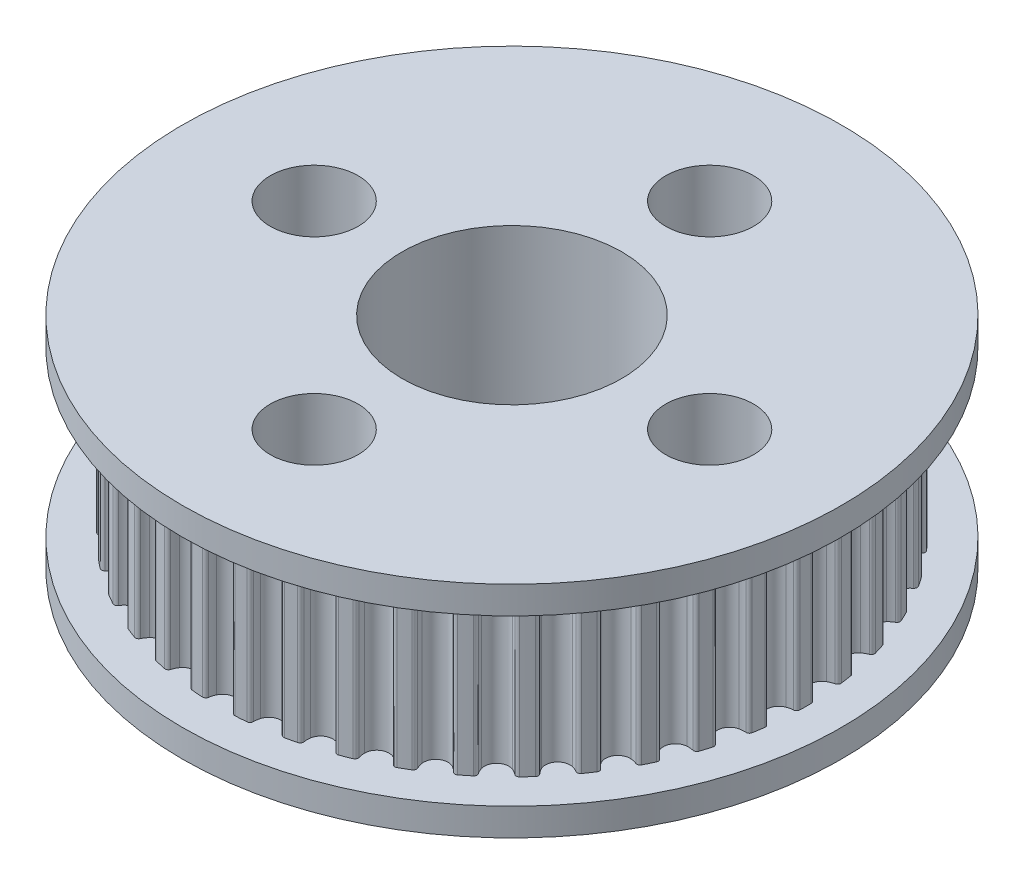
from build123d import *

# Parameters (mm, degrees)
BOSS_EXTRUDE1_DEPTH = 5
SKETCH3_R           = 15
BOSS_EXTRUDE2_DEPTH = 1.25
SKETCH4_R           = 2
SKETCH4_R_2         = 5
CUT_EXTRUDE1_DEPTH  = 24.452078799
SKETCH5_R           = 3.5
CUT_EXTRUDE2_DEPTH  = 2


with BuildPart() as part:
    # Sketch2 → Boss-Extrude1 (new, symmetric)
    with BuildSketch(Plane(origin=(0, 0, 0), x_dir=(1, 0, 0), z_dir=(0, 1, 0))):
        with BuildLine():
            ThreePointArc((-0.587933358, 13.215922323), (-0.641402083, 13.310557741), (-0.744749539, 13.344233703))
            ThreePointArc((-0.744749539, 13.344233703), (-0.998767701, 13.327628749), (-1.252423529, 13.306188797))
            ThreePointArc((-1.252423529, 13.306188797), (-1.349597538, 13.257485829), (-1.388364385, 13.15593831))
            ThreePointArc((-1.388364385, 13.15593831), (-1.398406592, 13.008375791), (-1.43010426, 12.863908491))
            ThreePointArc((-1.43010426, 12.863908491), (-1.880019146, 12.473112042), (-2.42513485, 12.713931761))
            ThreePointArc((-2.42513485, 12.713931761), (-2.498006764, 12.842637732), (-2.55109764, 12.98068447))
            ThreePointArc((-2.55109764, 12.98068447), (-2.618073842, 13.066293789), (-2.725286134, 13.084190479))
            ThreePointArc((-2.725286134, 13.084190479), (-2.973992282, 13.029911546), (-3.221619526, 12.970905621))
            ThreePointArc((-3.221619526, 12.970905621), (-3.31044938, 12.90826359), (-3.333648361, 12.802072375))
            ThreePointArc((-3.333648361, 12.802072375), (-3.321585353, 12.654661294), (-3.331397251, 12.507083282))
            ThreePointArc((-3.331397251, 12.507083282), (-3.71804177, 12.053595372), (-4.292961299, 12.210480054))
            ThreePointArc((-4.292961299, 12.210480054), (-4.384201924, 12.326887491), (-4.457274617, 12.455479576))
            ThreePointArc((-4.457274617, 12.455479576), (-4.536262157, 12.530150425), (-4.644944339, 12.53186806))
            ThreePointArc((-4.644944339, 12.53186806), (-4.882782791, 12.441127651), (-5.118849866, 12.345873847))
            ThreePointArc((-5.118849866, 12.345873847), (-5.197351254, 12.270692074), (-5.204464142, 12.162229297))
            ThreePointArc((-5.204464142, 12.162229297), (-5.170565386, 12.018262574), (-5.158272331, 11.8708705))
            ThreePointArc((-5.158272331, 11.8708705), (-5.473009485, 11.3648213), (-6.064890087, 11.4342664))
            ThreePointArc((-6.064890087, 11.4342664), (-6.172461257, 11.535774952), (-6.263883445, 11.65203985))
            ThreePointArc((-6.263883445, 11.65203985), (-6.353117871, 11.714104205), (-6.460842164, 11.699604418))
            ThreePointArc((-6.460842164, 11.699604418), (-6.6825, 11.574429522), (-6.901733558, 11.445055653))
            ThreePointArc((-6.901733558, 11.445055653), (-6.968152889, 11.359013573), (-6.959020794, 11.250702115))
            ThreePointArc((-6.959020794, 11.250702115), (-6.904043532, 11.113395729), (-6.869920132, 10.969482086))
            ThreePointArc((-6.869920132, 10.969482086), (-7.105719212, 10.422175899), (-7.701339252, 10.402630129))
            ThreePointArc((-7.701339252, 10.402630129), (-7.822838006, 10.486972263), (-7.930567467, 10.588312808))
            ThreePointArc((-7.930567467, 10.588312808), (-8.028055431, 10.636384255), (-8.132415451, 10.605990945))
            ThreePointArc((-8.132415451, 10.605990945), (-8.332941202, 10.449177763), (-8.530443928, 10.288573827))
            ThreePointArc((-8.530443928, 10.288573827), (-8.583297503, 10.193593478), (-8.55812442, 10.087852838))
            ThreePointArc((-8.55812442, 10.087852838), (-8.483296754, 9.960273987), (-8.428105269, 9.82305357))
            ThreePointArc((-8.428105269, 9.82305357), (-8.579698914, 9.246716311), (-9.165753224, 9.13861629))
            ThreePointArc((-9.165753224, 9.13861629), (-9.29846548, 9.203907943), (-9.420095717, 9.288060355))
            ThreePointArc((-9.420095717, 9.288060355), (-9.523659498, 9.321065057), (-9.622324015, 9.275457161))
            ThreePointArc((-9.622324015, 9.275457161), (-9.797238267, 9.09050864), (-9.968598276, 8.902262264))
            ThreePointArc((-9.968598276, 8.902262264), (-10.006705434, 8.80046535), (-9.966053689, 8.699657599))
            ThreePointArc((-9.966053689, 8.699657599), (-9.873047146, 8.584656183), (-9.798020462, 8.457194269))
            ThreePointArc((-9.798020462, 8.457194269), (-9.86202232, 7.864700361), (-10.425419415, 7.670460865))
            ThreePointArc((-10.425419415, 7.670460865), (-10.566380601, 7.715243529), (-10.699194595, 7.780327982))
            ThreePointArc((-10.699194595, 7.780327982), (-10.806520749, 7.797528667), (-10.897285761, 7.737724991))
            ThreePointArc((-10.897285761, 7.737724991), (-11.042681219, 7.528772576), (-11.184070611, 7.317088872))
            ThreePointArc((-11.184070611, 7.317088872), (-11.206580101, 7.210749369), (-11.151357787, 7.117126385))
            ThreePointArc((-11.151357787, 7.117126385), (-11.042249978, 7.017271346), (-10.949064068, 6.902415222))
            ThreePointArc((-10.949064068, 6.902415222), (-10.924044443, 6.307), (-11.452198964, 6.030960019))
            ThreePointArc((-11.452198964, 6.030960019), (-11.59826024, 6.054233323), (-11.739291145, 6.098795938))
            ThreePointArc((-11.739291145, 6.098795938), (-11.847982184, 6.099808373), (-11.928820151, 6.027144831))
            ThreePointArc((-11.928820151, 6.027144831), (-12.04144892, 5.798856173), (-12.14970929, 5.568463806))
            ThreePointArc((-12.14970929, 5.568463806), (-12.156118287, 5.459957162), (-12.087558979, 5.375610328))
            ThreePointArc((-12.087558979, 5.375610328), (-11.964787193, 5.293132262), (-11.855523675, 5.193447626))
            ThreePointArc((-11.855523675, 5.193447626), (-11.742041465, 4.608411681), (-12.223155312, 4.256737492))
            ThreePointArc((-12.223155312, 4.256737492), (-12.37105391, 4.257981549), (-12.51715133, 4.281026871))
            ThreePointArc((-12.51715133, 4.281026871), (-12.624779275, 4.265828439), (-12.69388441, 4.181928215))
            ThreePointArc((-12.69388441, 4.181928215), (-12.771230549, 3.939402906), (-12.843943541, 3.69544846))
            ThreePointArc((-12.843943541, 3.69544846), (-12.834108878, 3.587198534), (-12.753744078, 3.514012019))
            ThreePointArc((-12.753744078, 3.514012019), (-12.620050833, 3.45075335), (-12.497150475, 3.368466992))
            ThreePointArc((-12.497150475, 3.368466992), (-12.297740684, 2.806879061), (-12.721066569, 2.387426484))
            ThreePointArc((-12.721066569, 2.387426484), (-12.867498678, 2.366613504), (-13.015399038, 2.367626738))
            ThreePointArc((-13.015399038, 2.367626738), (-13.119559659, 2.336556946), (-13.175388267, 2.243294233))
            ThreePointArc((-13.175388267, 2.243294233), (-13.215723992, 1.991949887), (-13.251265316, 1.739882902))
            ThreePointArc((-13.251265316, 1.739882902), (-13.225406685, 1.634307819), (-13.135031609, 1.573916489))
            ThreePointArc((-13.135031609, 1.573916489), (-12.993403392, 1.531290311), (-12.859611583, 1.468240371))
            ThreePointArc((-12.859611583, 1.468240371), (-12.578728698, 0.9426454), (-12.934810219, 0.464784313))
            ThreePointArc((-12.934810219, 0.464784313), (-13.076504789, 0.422379223), (-13.222904238, 0.401337735))
            ThreePointArc((-13.222904238, 0.401337735), (-13.32127076, 0.355090633), (-13.362575722, 0.254548765))
            ThreePointArc((-13.362575722, 0.254548765), (-13.365, 0), (-13.362575722, -0.254548765))
            ThreePointArc((-13.362575722, -0.254548765), (-13.32127076, -0.355090633), (-13.222904238, -0.401337735))
            ThreePointArc((-13.222904238, -0.401337735), (-13.076504789, -0.422379223), (-12.934810219, -0.464784313))
            ThreePointArc((-12.934810219, -0.464784313), (-12.578728698, -0.9426454), (-12.859611583, -1.468240371))
            ThreePointArc((-12.859611583, -1.468240371), (-12.993403392, -1.531290311), (-13.135031609, -1.573916489))
            ThreePointArc((-13.135031609, -1.573916489), (-13.225406685, -1.634307819), (-13.251265316, -1.739882902))
            ThreePointArc((-13.251265316, -1.739882902), (-13.215723992, -1.991949887), (-13.175388267, -2.243294233))
            ThreePointArc((-13.175388267, -2.243294233), (-13.119559659, -2.336556946), (-13.015399038, -2.367626738))
            ThreePointArc((-13.015399038, -2.367626738), (-12.867498678, -2.366613504), (-12.721066569, -2.387426484))
            ThreePointArc((-12.721066569, -2.387426484), (-12.297740684, -2.806879061), (-12.497150475, -3.368466992))
            ThreePointArc((-12.497150475, -3.368466992), (-12.620050833, -3.45075335), (-12.753744078, -3.514012019))
            ThreePointArc((-12.753744078, -3.514012019), (-12.834108878, -3.587198534), (-12.843943541, -3.69544846))
            ThreePointArc((-12.843943541, -3.69544846), (-12.771230549, -3.939402906), (-12.69388441, -4.181928215))
            ThreePointArc((-12.69388441, -4.181928215), (-12.624779275, -4.265828439), (-12.51715133, -4.281026871))
            ThreePointArc((-12.51715133, -4.281026871), (-12.37105391, -4.257981549), (-12.223155312, -4.256737492))
            ThreePointArc((-12.223155312, -4.256737492), (-11.742041465, -4.608411681), (-11.855523675, -5.193447626))
            ThreePointArc((-11.855523675, -5.193447626), (-11.964787193, -5.293132262), (-12.087558979, -5.375610328))
            ThreePointArc((-12.087558979, -5.375610328), (-12.156118287, -5.459957162), (-12.14970929, -5.568463806))
            ThreePointArc((-12.14970929, -5.568463806), (-12.04144892, -5.798856173), (-11.928820151, -6.027144831))
            ThreePointArc((-11.928820151, -6.027144831), (-11.847982184, -6.099808373), (-11.739291145, -6.098795938))
            ThreePointArc((-11.739291145, -6.098795938), (-11.59826024, -6.054233323), (-11.452198964, -6.030960019))
            ThreePointArc((-11.452198964, -6.030960019), (-10.924044443, -6.307), (-10.949064068, -6.902415222))
            ThreePointArc((-10.949064068, -6.902415222), (-11.042249978, -7.017271346), (-11.151357787, -7.117126385))
            ThreePointArc((-11.151357787, -7.117126385), (-11.206580101, -7.210749369), (-11.184070611, -7.317088872))
            ThreePointArc((-11.184070611, -7.317088872), (-11.042681219, -7.528772576), (-10.897285761, -7.737724991))
            ThreePointArc((-10.897285761, -7.737724991), (-10.806520749, -7.797528667), (-10.699194595, -7.780327982))
            ThreePointArc((-10.699194595, -7.780327982), (-10.566380601, -7.715243529), (-10.425419415, -7.670460865))
            ThreePointArc((-10.425419415, -7.670460865), (-9.86202232, -7.864700361), (-9.798020462, -8.457194269))
            ThreePointArc((-9.798020462, -8.457194269), (-9.873047146, -8.584656183), (-9.966053689, -8.699657599))
            ThreePointArc((-9.966053689, -8.699657599), (-10.006705434, -8.80046535), (-9.968598276, -8.902262264))
            ThreePointArc((-9.968598276, -8.902262264), (-9.797238267, -9.09050864), (-9.622324015, -9.275457161))
            ThreePointArc((-9.622324015, -9.275457161), (-9.523659498, -9.321065057), (-9.420095717, -9.288060355))
            ThreePointArc((-9.420095717, -9.288060355), (-9.29846548, -9.203907943), (-9.165753224, -9.13861629))
            ThreePointArc((-9.165753224, -9.13861629), (-8.579698914, -9.246716311), (-8.428105269, -9.82305357))
            ThreePointArc((-8.428105269, -9.82305357), (-8.483296754, -9.960273987), (-8.55812442, -10.087852838))
            ThreePointArc((-8.55812442, -10.087852838), (-8.583297503, -10.193593478), (-8.530443928, -10.288573827))
            ThreePointArc((-8.530443928, -10.288573827), (-8.332941202, -10.449177763), (-8.132415451, -10.605990945))
            ThreePointArc((-8.132415451, -10.605990945), (-8.028055431, -10.636384255), (-7.930567467, -10.588312808))
            ThreePointArc((-7.930567467, -10.588312808), (-7.822838006, -10.486972263), (-7.701339252, -10.402630129))
            ThreePointArc((-7.701339252, -10.402630129), (-7.105719212, -10.422175899), (-6.869920132, -10.969482086))
            ThreePointArc((-6.869920132, -10.969482086), (-6.904043532, -11.113395729), (-6.959020794, -11.250702115))
            ThreePointArc((-6.959020794, -11.250702115), (-6.968152889, -11.359013573), (-6.901733558, -11.445055653))
            ThreePointArc((-6.901733558, -11.445055653), (-6.6825, -11.574429522), (-6.460842164, -11.699604418))
            ThreePointArc((-6.460842164, -11.699604418), (-6.353117871, -11.714104205), (-6.263883445, -11.65203985))
            ThreePointArc((-6.263883445, -11.65203985), (-6.172461257, -11.535774952), (-6.064890087, -11.4342664))
            ThreePointArc((-6.064890087, -11.4342664), (-5.473009485, -11.3648213), (-5.158272331, -11.8708705))
            ThreePointArc((-5.158272331, -11.8708705), (-5.170565386, -12.018262574), (-5.204464142, -12.162229297))
            ThreePointArc((-5.204464142, -12.162229297), (-5.197351254, -12.270692074), (-5.118849866, -12.345873847))
            ThreePointArc((-5.118849866, -12.345873847), (-4.882782791, -12.441127651), (-4.644944339, -12.53186806))
            ThreePointArc((-4.644944339, -12.53186806), (-4.536262157, -12.530150425), (-4.457274617, -12.455479576))
            ThreePointArc((-4.457274617, -12.455479576), (-4.384201924, -12.326887491), (-4.292961299, -12.210480054))
            ThreePointArc((-4.292961299, -12.210480054), (-3.71804177, -12.053595372), (-3.331397251, -12.507083282))
            ThreePointArc((-3.331397251, -12.507083282), (-3.321585353, -12.654661294), (-3.333648361, -12.802072375))
            ThreePointArc((-3.333648361, -12.802072375), (-3.31044938, -12.90826359), (-3.221619526, -12.970905621))
            ThreePointArc((-3.221619526, -12.970905621), (-2.973992282, -13.029911546), (-2.725286134, -13.084190479))
            ThreePointArc((-2.725286134, -13.084190479), (-2.618073842, -13.066293789), (-2.55109764, -12.98068447))
            ThreePointArc((-2.55109764, -12.98068447), (-2.498006764, -12.842637732), (-2.42513485, -12.713931761))
            ThreePointArc((-2.42513485, -12.713931761), (-1.880019146, -12.473112042), (-1.43010426, -12.863908491))
            ThreePointArc((-1.43010426, -12.863908491), (-1.398406592, -13.008375791), (-1.388364385, -13.15593831))
            ThreePointArc((-1.388364385, -13.15593831), (-1.349597538, -13.257485829), (-1.252423529, -13.306188797))
            ThreePointArc((-1.252423529, -13.306188797), (-0.998767701, -13.327628749), (-0.744749539, -13.344233703))
            ThreePointArc((-0.744749539, -13.344233703), (-0.641402083, -13.310557741), (-0.587933358, -13.215922323))
            ThreePointArc((-0.587933358, -13.215922323), (-0.556010261, -13.071504669), (-0.503134896, -12.933375242))
            ThreePointArc((-0.503134896, -12.933375242), (0, -12.614), (0.503134896, -12.933375242))
            ThreePointArc((0.503134896, -12.933375242), (0.556010261, -13.071504669), (0.587933358, -13.215922323))
            ThreePointArc((0.587933358, -13.215922323), (0.641402083, -13.310557741), (0.744749539, -13.344233703))
            ThreePointArc((0.744749539, -13.344233703), (0.998767701, -13.327628749), (1.252423529, -13.306188797))
            ThreePointArc((1.252423529, -13.306188797), (1.349597538, -13.257485829), (1.388364385, -13.15593831))
            ThreePointArc((1.388364385, -13.15593831), (1.398406592, -13.008375791), (1.43010426, -12.863908491))
            ThreePointArc((1.43010426, -12.863908491), (1.880019146, -12.473112042), (2.42513485, -12.713931761))
            ThreePointArc((2.42513485, -12.713931761), (2.498006764, -12.842637732), (2.55109764, -12.98068447))
            ThreePointArc((2.55109764, -12.98068447), (2.618073842, -13.066293789), (2.725286134, -13.084190479))
            ThreePointArc((2.725286134, -13.084190479), (2.973992282, -13.029911546), (3.221619526, -12.970905621))
            ThreePointArc((3.221619526, -12.970905621), (3.31044938, -12.90826359), (3.333648361, -12.802072375))
            ThreePointArc((3.333648361, -12.802072375), (3.321585353, -12.654661294), (3.331397251, -12.507083282))
            ThreePointArc((3.331397251, -12.507083282), (3.71804177, -12.053595372), (4.292961299, -12.210480054))
            ThreePointArc((4.292961299, -12.210480054), (4.384201924, -12.326887491), (4.457274617, -12.455479576))
            ThreePointArc((4.457274617, -12.455479576), (4.536262157, -12.530150425), (4.644944339, -12.53186806))
            ThreePointArc((4.644944339, -12.53186806), (4.882782791, -12.441127651), (5.118849866, -12.345873847))
            ThreePointArc((5.118849866, -12.345873847), (5.197351254, -12.270692074), (5.204464142, -12.162229297))
            ThreePointArc((5.204464142, -12.162229297), (5.170565386, -12.018262574), (5.158272331, -11.8708705))
            ThreePointArc((5.158272331, -11.8708705), (5.473009485, -11.3648213), (6.064890087, -11.4342664))
            ThreePointArc((6.064890087, -11.4342664), (6.172461257, -11.535774952), (6.263883445, -11.65203985))
            ThreePointArc((6.263883445, -11.65203985), (6.353117871, -11.714104205), (6.460842164, -11.699604418))
            ThreePointArc((6.460842164, -11.699604418), (6.6825, -11.574429522), (6.901733558, -11.445055653))
            ThreePointArc((6.901733558, -11.445055653), (6.968152889, -11.359013573), (6.959020794, -11.250702115))
            ThreePointArc((6.959020794, -11.250702115), (6.904043532, -11.113395729), (6.869920132, -10.969482086))
            ThreePointArc((6.869920132, -10.969482086), (7.105719212, -10.422175899), (7.701339252, -10.402630129))
            ThreePointArc((7.701339252, -10.402630129), (7.822838006, -10.486972263), (7.930567467, -10.588312808))
            ThreePointArc((7.930567467, -10.588312808), (8.028055431, -10.636384255), (8.132415451, -10.605990945))
            ThreePointArc((8.132415451, -10.605990945), (8.332941202, -10.449177763), (8.530443928, -10.288573827))
            ThreePointArc((8.530443928, -10.288573827), (8.583297503, -10.193593478), (8.55812442, -10.087852838))
            ThreePointArc((8.55812442, -10.087852838), (8.483296754, -9.960273987), (8.428105269, -9.82305357))
            ThreePointArc((8.428105269, -9.82305357), (8.579698914, -9.246716311), (9.165753224, -9.13861629))
            ThreePointArc((9.165753224, -9.13861629), (9.29846548, -9.203907943), (9.420095717, -9.288060355))
            ThreePointArc((9.420095717, -9.288060355), (9.523659498, -9.321065057), (9.622324015, -9.275457161))
            ThreePointArc((9.622324015, -9.275457161), (9.797238267, -9.09050864), (9.968598276, -8.902262264))
            ThreePointArc((9.968598276, -8.902262264), (10.006705434, -8.80046535), (9.966053689, -8.699657599))
            ThreePointArc((9.966053689, -8.699657599), (9.873047146, -8.584656183), (9.798020462, -8.457194269))
            ThreePointArc((9.798020462, -8.457194269), (9.86202232, -7.864700361), (10.425419415, -7.670460865))
            ThreePointArc((10.425419415, -7.670460865), (10.566380601, -7.715243529), (10.699194595, -7.780327982))
            ThreePointArc((10.699194595, -7.780327982), (10.806520749, -7.797528667), (10.897285761, -7.737724991))
            ThreePointArc((10.897285761, -7.737724991), (11.042681219, -7.528772576), (11.184070611, -7.317088872))
            ThreePointArc((11.184070611, -7.317088872), (11.206580101, -7.210749369), (11.151357787, -7.117126385))
            ThreePointArc((11.151357787, -7.117126385), (11.042249978, -7.017271346), (10.949064068, -6.902415222))
            ThreePointArc((10.949064068, -6.902415222), (10.924044443, -6.307), (11.452198964, -6.030960019))
            ThreePointArc((11.452198964, -6.030960019), (11.59826024, -6.054233323), (11.739291145, -6.098795938))
            ThreePointArc((11.739291145, -6.098795938), (11.847982184, -6.099808373), (11.928820151, -6.027144831))
            ThreePointArc((11.928820151, -6.027144831), (12.04144892, -5.798856173), (12.14970929, -5.568463806))
            ThreePointArc((12.14970929, -5.568463806), (12.156118287, -5.459957162), (12.087558979, -5.375610328))
            ThreePointArc((12.087558979, -5.375610328), (11.964787193, -5.293132262), (11.855523675, -5.193447626))
            ThreePointArc((11.855523675, -5.193447626), (11.742041465, -4.608411681), (12.223155312, -4.256737492))
            ThreePointArc((12.223155312, -4.256737492), (12.37105391, -4.257981549), (12.51715133, -4.281026871))
            ThreePointArc((12.51715133, -4.281026871), (12.624779275, -4.265828439), (12.69388441, -4.181928215))
            ThreePointArc((12.69388441, -4.181928215), (12.771230549, -3.939402906), (12.843943541, -3.69544846))
            ThreePointArc((12.843943541, -3.69544846), (12.834108878, -3.587198534), (12.753744078, -3.514012019))
            ThreePointArc((12.753744078, -3.514012019), (12.620050833, -3.45075335), (12.497150475, -3.368466992))
            ThreePointArc((12.497150475, -3.368466992), (12.297740684, -2.806879061), (12.721066569, -2.387426484))
            ThreePointArc((12.721066569, -2.387426484), (12.867498678, -2.366613504), (13.015399038, -2.367626738))
            ThreePointArc((13.015399038, -2.367626738), (13.119559659, -2.336556946), (13.175388267, -2.243294233))
            ThreePointArc((13.175388267, -2.243294233), (13.215723992, -1.991949887), (13.251265316, -1.739882902))
            ThreePointArc((13.251265316, -1.739882902), (13.225406685, -1.634307819), (13.135031609, -1.573916489))
            ThreePointArc((13.135031609, -1.573916489), (12.993403392, -1.531290311), (12.859611583, -1.468240371))
            ThreePointArc((12.859611583, -1.468240371), (12.578728698, -0.9426454), (12.934810219, -0.464784313))
            ThreePointArc((12.934810219, -0.464784313), (13.076504789, -0.422379223), (13.222904238, -0.401337735))
            ThreePointArc((13.222904238, -0.401337735), (13.32127076, -0.355090633), (13.362575722, -0.254548765))
            ThreePointArc((13.362575722, -0.254548765), (13.365, 0), (13.362575722, 0.254548765))
            ThreePointArc((13.362575722, 0.254548765), (13.32127076, 0.355090633), (13.222904238, 0.401337735))
            ThreePointArc((13.222904238, 0.401337735), (13.076504789, 0.422379223), (12.934810219, 0.464784313))
            ThreePointArc((12.934810219, 0.464784313), (12.578728698, 0.9426454), (12.859611583, 1.468240371))
            ThreePointArc((12.859611583, 1.468240371), (12.993403392, 1.531290311), (13.135031609, 1.573916489))
            ThreePointArc((13.135031609, 1.573916489), (13.225406685, 1.634307819), (13.251265316, 1.739882902))
            ThreePointArc((13.251265316, 1.739882902), (13.215723992, 1.991949887), (13.175388267, 2.243294233))
            ThreePointArc((13.175388267, 2.243294233), (13.119559659, 2.336556946), (13.015399038, 2.367626738))
            ThreePointArc((13.015399038, 2.367626738), (12.867498678, 2.366613504), (12.721066569, 2.387426484))
            ThreePointArc((12.721066569, 2.387426484), (12.297740684, 2.806879061), (12.497150475, 3.368466992))
            ThreePointArc((12.497150475, 3.368466992), (12.620050833, 3.45075335), (12.753744078, 3.514012019))
            ThreePointArc((12.753744078, 3.514012019), (12.834108878, 3.587198534), (12.843943541, 3.69544846))
            ThreePointArc((12.843943541, 3.69544846), (12.771230549, 3.939402906), (12.69388441, 4.181928215))
            ThreePointArc((12.69388441, 4.181928215), (12.624779275, 4.265828439), (12.51715133, 4.281026871))
            ThreePointArc((12.51715133, 4.281026871), (12.37105391, 4.257981549), (12.223155312, 4.256737492))
            ThreePointArc((12.223155312, 4.256737492), (11.742041465, 4.608411681), (11.855523675, 5.193447626))
            ThreePointArc((11.855523675, 5.193447626), (11.964787193, 5.293132262), (12.087558979, 5.375610328))
            ThreePointArc((12.087558979, 5.375610328), (12.156118287, 5.459957162), (12.14970929, 5.568463806))
            ThreePointArc((12.14970929, 5.568463806), (12.04144892, 5.798856173), (11.928820151, 6.027144831))
            ThreePointArc((11.928820151, 6.027144831), (11.847982184, 6.099808373), (11.739291145, 6.098795938))
            ThreePointArc((11.739291145, 6.098795938), (11.59826024, 6.054233323), (11.452198964, 6.030960019))
            ThreePointArc((11.452198964, 6.030960019), (10.924044443, 6.307), (10.949064068, 6.902415222))
            ThreePointArc((10.949064068, 6.902415222), (11.042249978, 7.017271346), (11.151357787, 7.117126385))
            ThreePointArc((11.151357787, 7.117126385), (11.206580101, 7.210749369), (11.184070611, 7.317088872))
            ThreePointArc((11.184070611, 7.317088872), (11.042681219, 7.528772576), (10.897285761, 7.737724991))
            ThreePointArc((10.897285761, 7.737724991), (10.806520749, 7.797528667), (10.699194595, 7.780327982))
            ThreePointArc((10.699194595, 7.780327982), (10.566380601, 7.715243529), (10.425419415, 7.670460865))
            ThreePointArc((10.425419415, 7.670460865), (9.86202232, 7.864700361), (9.798020462, 8.457194269))
            ThreePointArc((9.798020462, 8.457194269), (9.873047146, 8.584656183), (9.966053689, 8.699657599))
            ThreePointArc((9.966053689, 8.699657599), (10.006705434, 8.80046535), (9.968598276, 8.902262264))
            ThreePointArc((9.968598276, 8.902262264), (9.797238267, 9.09050864), (9.622324015, 9.275457161))
            ThreePointArc((9.622324015, 9.275457161), (9.523659498, 9.321065057), (9.420095717, 9.288060355))
            ThreePointArc((9.420095717, 9.288060355), (9.29846548, 9.203907943), (9.165753224, 9.13861629))
            ThreePointArc((9.165753224, 9.13861629), (8.579698914, 9.246716311), (8.428105269, 9.82305357))
            ThreePointArc((8.428105269, 9.82305357), (8.483296754, 9.960273987), (8.55812442, 10.087852838))
            ThreePointArc((8.55812442, 10.087852838), (8.583297503, 10.193593478), (8.530443928, 10.288573827))
            ThreePointArc((8.530443928, 10.288573827), (8.332941202, 10.449177763), (8.132415451, 10.605990945))
            ThreePointArc((8.132415451, 10.605990945), (8.028055431, 10.636384255), (7.930567467, 10.588312808))
            ThreePointArc((7.930567467, 10.588312808), (7.822838006, 10.486972263), (7.701339252, 10.402630129))
            ThreePointArc((7.701339252, 10.402630129), (7.105719212, 10.422175899), (6.869920132, 10.969482086))
            ThreePointArc((6.869920132, 10.969482086), (6.904043532, 11.113395729), (6.959020794, 11.250702115))
            ThreePointArc((6.959020794, 11.250702115), (6.968152889, 11.359013573), (6.901733558, 11.445055653))
            ThreePointArc((6.901733558, 11.445055653), (6.6825, 11.574429522), (6.460842164, 11.699604418))
            ThreePointArc((6.460842164, 11.699604418), (6.353117871, 11.714104205), (6.263883445, 11.65203985))
            ThreePointArc((6.263883445, 11.65203985), (6.172461257, 11.535774952), (6.064890087, 11.4342664))
            ThreePointArc((6.064890087, 11.4342664), (5.473009485, 11.3648213), (5.158272331, 11.8708705))
            ThreePointArc((5.158272331, 11.8708705), (5.170565386, 12.018262574), (5.204464142, 12.162229297))
            ThreePointArc((5.204464142, 12.162229297), (5.197351254, 12.270692074), (5.118849866, 12.345873847))
            ThreePointArc((5.118849866, 12.345873847), (4.882782791, 12.441127651), (4.644944339, 12.53186806))
            ThreePointArc((4.644944339, 12.53186806), (4.536262157, 12.530150425), (4.457274617, 12.455479576))
            ThreePointArc((4.457274617, 12.455479576), (4.384201924, 12.326887491), (4.292961299, 12.210480054))
            ThreePointArc((4.292961299, 12.210480054), (3.71804177, 12.053595372), (3.331397251, 12.507083282))
            ThreePointArc((3.331397251, 12.507083282), (3.321585353, 12.654661294), (3.333648361, 12.802072375))
            ThreePointArc((3.333648361, 12.802072375), (3.31044938, 12.90826359), (3.221619526, 12.970905621))
            ThreePointArc((3.221619526, 12.970905621), (2.973992282, 13.029911546), (2.725286134, 13.084190479))
            ThreePointArc((2.725286134, 13.084190479), (2.618073842, 13.066293789), (2.55109764, 12.98068447))
            ThreePointArc((2.55109764, 12.98068447), (2.498006764, 12.842637732), (2.42513485, 12.713931761))
            ThreePointArc((2.42513485, 12.713931761), (1.880019146, 12.473112042), (1.43010426, 12.863908491))
            ThreePointArc((1.43010426, 12.863908491), (1.398406592, 13.008375791), (1.388364385, 13.15593831))
            ThreePointArc((1.388364385, 13.15593831), (1.349597538, 13.257485829), (1.252423529, 13.306188797))
            ThreePointArc((1.252423529, 13.306188797), (0.998767701, 13.327628749), (0.744749539, 13.344233703))
            ThreePointArc((0.744749539, 13.344233703), (0.641402083, 13.310557741), (0.587933358, 13.215922323))
            ThreePointArc((0.587933358, 13.215922323), (0.556010261, 13.071504669), (0.503134896, 12.933375242))
            ThreePointArc((0.503134896, 12.933375242), (0, 12.614), (-0.503134896, 12.933375242))
            ThreePointArc((-0.503134896, 12.933375242), (-0.556010261, 13.071504669), (-0.587933358, 13.215922323))
        make_face()
    extrude(amount=BOSS_EXTRUDE1_DEPTH, both=True)

    # Sketch3 → Boss-Extrude2 (add)
    with BuildSketch(Plane(origin=(0, 5, 0), x_dir=(1, 0, 0), z_dir=(0, 1, 0))):
        Circle(SKETCH3_R)
    boss_extrude2 = extrude(amount=-BOSS_EXTRUDE2_DEPTH)

    # Mirror1: Boss-Extrude2 across plane
    add(boss_extrude2.mirror(Plane.ZX))

    # Sketch4 → Cut-Extrude1 (cut, through all)
    with BuildSketch(Plane(origin=(0, 5, 0), x_dir=(1, 0, 0), z_dir=(0, 1, 0))):
        with Locations((9, 0)):
            Circle(SKETCH4_R)
        with Locations((0, 9)):
            Circle(SKETCH4_R)
        with Locations((0, -9)):
            Circle(SKETCH4_R)
        with Locations((-9, 0)):
            Circle(SKETCH4_R)
        Circle(SKETCH4_R_2)
    extrude(amount=-CUT_EXTRUDE1_DEPTH, mode=Mode.SUBTRACT)

    # Sketch5 → Cut-Extrude2 (cut)
    with BuildSketch(Plane.XZ.offset(5)):
        with Locations((0, 9)):
            Circle(SKETCH5_R)
        with Locations((9, 0)):
            Circle(SKETCH5_R)
        with Locations((0, -9)):
            Circle(SKETCH5_R)
        with Locations((-9, 0)):
            Circle(SKETCH5_R)
    extrude(amount=-CUT_EXTRUDE2_DEPTH, mode=Mode.SUBTRACT)


solid = part.part
